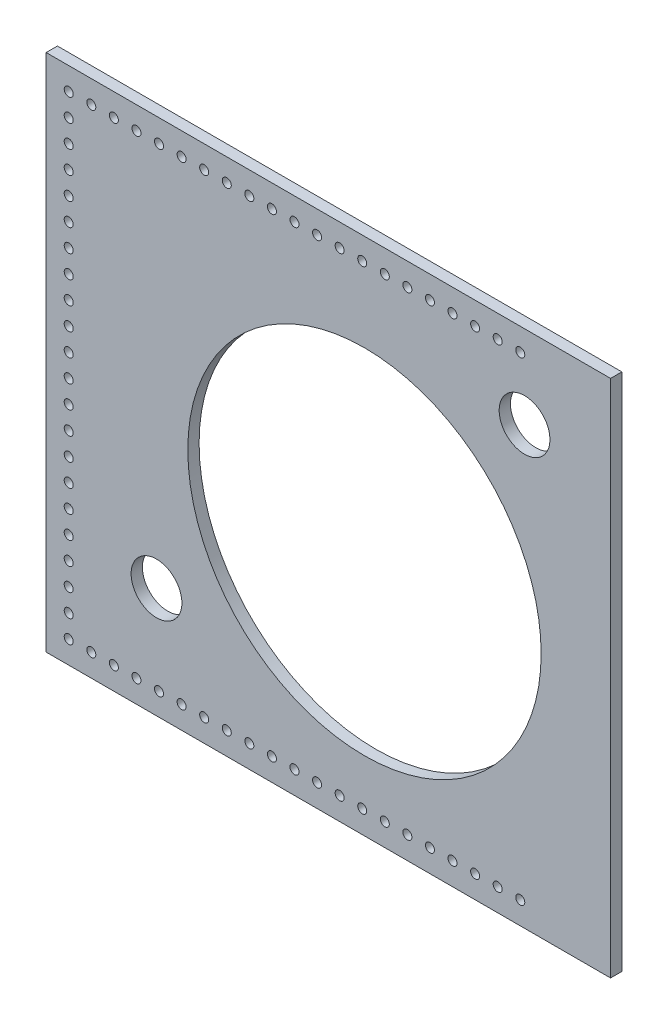
from build123d import *

# Parameters (mm, degrees)
SKETCH1_W           = 317.5
SKETCH1_H           = 292.1
SKETCH1_R           = 99.3775
SKETCH1_R_2         = 2.54
BOSS_EXTRUDE1_DEPTH = 6.35
SKETCH2_R           = 14.2875
CUT_EXTRUDE1_DEPTH  = 432.473037976


with BuildPart() as part:
    # Sketch1 → Boss-Extrude1 (new body)
    with BuildSketch(Plane.XY):
        with Locations((158.75, 146.05)):
            Rectangle(SKETCH1_W, SKETCH1_H)
        with Locations((179.07, 138.43)):
            Circle(SKETCH1_R, mode=Mode.SUBTRACT)
        with Locations((12.7, 279.4)):
            Circle(SKETCH1_R_2, mode=Mode.SUBTRACT)
        with Locations((25.4, 279.4)):
            Circle(SKETCH1_R_2, mode=Mode.SUBTRACT)
        with Locations((38.1, 279.4)):
            Circle(SKETCH1_R_2, mode=Mode.SUBTRACT)
        with Locations((50.8, 279.4)):
            Circle(SKETCH1_R_2, mode=Mode.SUBTRACT)
        with Locations((63.5, 279.4)):
            Circle(SKETCH1_R_2, mode=Mode.SUBTRACT)
        with Locations((76.2, 279.4)):
            Circle(SKETCH1_R_2, mode=Mode.SUBTRACT)
        with Locations((88.9, 279.4)):
            Circle(SKETCH1_R_2, mode=Mode.SUBTRACT)
        with Locations((101.6, 279.4)):
            Circle(SKETCH1_R_2, mode=Mode.SUBTRACT)
        with Locations((114.3, 279.4)):
            Circle(SKETCH1_R_2, mode=Mode.SUBTRACT)
        with Locations((127, 279.4)):
            Circle(SKETCH1_R_2, mode=Mode.SUBTRACT)
        with Locations((139.7, 279.4)):
            Circle(SKETCH1_R_2, mode=Mode.SUBTRACT)
        with Locations((152.4, 279.4)):
            Circle(SKETCH1_R_2, mode=Mode.SUBTRACT)
        with Locations((165.1, 279.4)):
            Circle(SKETCH1_R_2, mode=Mode.SUBTRACT)
        with Locations((177.8, 279.4)):
            Circle(SKETCH1_R_2, mode=Mode.SUBTRACT)
        with Locations((190.5, 279.4)):
            Circle(SKETCH1_R_2, mode=Mode.SUBTRACT)
        with Locations((203.2, 279.4)):
            Circle(SKETCH1_R_2, mode=Mode.SUBTRACT)
        with Locations((215.9, 279.4)):
            Circle(SKETCH1_R_2, mode=Mode.SUBTRACT)
        with Locations((228.6, 279.4)):
            Circle(SKETCH1_R_2, mode=Mode.SUBTRACT)
        with Locations((241.3, 279.4)):
            Circle(SKETCH1_R_2, mode=Mode.SUBTRACT)
        with Locations((254, 279.4)):
            Circle(SKETCH1_R_2, mode=Mode.SUBTRACT)
        with Locations((266.7, 279.4)):
            Circle(SKETCH1_R_2, mode=Mode.SUBTRACT)
        with Locations((12.7, 266.7)):
            Circle(SKETCH1_R_2, mode=Mode.SUBTRACT)
        with Locations((12.7, 254)):
            Circle(SKETCH1_R_2, mode=Mode.SUBTRACT)
        with Locations((12.7, 241.3)):
            Circle(SKETCH1_R_2, mode=Mode.SUBTRACT)
        with Locations((12.7, 228.6)):
            Circle(SKETCH1_R_2, mode=Mode.SUBTRACT)
        with Locations((12.7, 215.9)):
            Circle(SKETCH1_R_2, mode=Mode.SUBTRACT)
        with Locations((12.7, 203.2)):
            Circle(SKETCH1_R_2, mode=Mode.SUBTRACT)
        with Locations((12.7, 190.5)):
            Circle(SKETCH1_R_2, mode=Mode.SUBTRACT)
        with Locations((12.7, 177.8)):
            Circle(SKETCH1_R_2, mode=Mode.SUBTRACT)
        with Locations((12.7, 165.1)):
            Circle(SKETCH1_R_2, mode=Mode.SUBTRACT)
        with Locations((12.7, 152.4)):
            Circle(SKETCH1_R_2, mode=Mode.SUBTRACT)
        with Locations((12.7, 139.7)):
            Circle(SKETCH1_R_2, mode=Mode.SUBTRACT)
        with Locations((12.7, 127)):
            Circle(SKETCH1_R_2, mode=Mode.SUBTRACT)
        with Locations((12.7, 114.3)):
            Circle(SKETCH1_R_2, mode=Mode.SUBTRACT)
        with Locations((12.7, 101.6)):
            Circle(SKETCH1_R_2, mode=Mode.SUBTRACT)
        with Locations((12.7, 88.9)):
            Circle(SKETCH1_R_2, mode=Mode.SUBTRACT)
        with Locations((12.7, 76.2)):
            Circle(SKETCH1_R_2, mode=Mode.SUBTRACT)
        with Locations((12.7, 63.5)):
            Circle(SKETCH1_R_2, mode=Mode.SUBTRACT)
        with Locations((12.7, 50.8)):
            Circle(SKETCH1_R_2, mode=Mode.SUBTRACT)
        with Locations((12.7, 38.1)):
            Circle(SKETCH1_R_2, mode=Mode.SUBTRACT)
        with Locations((12.7, 25.4)):
            Circle(SKETCH1_R_2, mode=Mode.SUBTRACT)
        with Locations((12.7, 12.7)):
            Circle(SKETCH1_R_2, mode=Mode.SUBTRACT)
        with Locations((25.4, 12.7)):
            Circle(SKETCH1_R_2, mode=Mode.SUBTRACT)
        with Locations((38.1, 12.7)):
            Circle(SKETCH1_R_2, mode=Mode.SUBTRACT)
        with Locations((50.8, 12.7)):
            Circle(SKETCH1_R_2, mode=Mode.SUBTRACT)
        with Locations((63.5, 12.7)):
            Circle(SKETCH1_R_2, mode=Mode.SUBTRACT)
        with Locations((76.2, 12.7)):
            Circle(SKETCH1_R_2, mode=Mode.SUBTRACT)
        with Locations((88.9, 12.7)):
            Circle(SKETCH1_R_2, mode=Mode.SUBTRACT)
        with Locations((101.6, 12.7)):
            Circle(SKETCH1_R_2, mode=Mode.SUBTRACT)
        with Locations((114.3, 12.7)):
            Circle(SKETCH1_R_2, mode=Mode.SUBTRACT)
        with Locations((127, 12.7)):
            Circle(SKETCH1_R_2, mode=Mode.SUBTRACT)
        with Locations((139.7, 12.7)):
            Circle(SKETCH1_R_2, mode=Mode.SUBTRACT)
        with Locations((152.4, 12.7)):
            Circle(SKETCH1_R_2, mode=Mode.SUBTRACT)
        with Locations((165.1, 12.7)):
            Circle(SKETCH1_R_2, mode=Mode.SUBTRACT)
        with Locations((177.8, 12.7)):
            Circle(SKETCH1_R_2, mode=Mode.SUBTRACT)
        with Locations((190.5, 12.7)):
            Circle(SKETCH1_R_2, mode=Mode.SUBTRACT)
        with Locations((203.2, 12.7)):
            Circle(SKETCH1_R_2, mode=Mode.SUBTRACT)
        with Locations((215.9, 12.7)):
            Circle(SKETCH1_R_2, mode=Mode.SUBTRACT)
        with Locations((228.6, 12.7)):
            Circle(SKETCH1_R_2, mode=Mode.SUBTRACT)
        with Locations((241.3, 12.7)):
            Circle(SKETCH1_R_2, mode=Mode.SUBTRACT)
        with Locations((254, 12.7)):
            Circle(SKETCH1_R_2, mode=Mode.SUBTRACT)
        with Locations((266.7, 12.7)):
            Circle(SKETCH1_R_2, mode=Mode.SUBTRACT)
    extrude(amount=BOSS_EXTRUDE1_DEPTH)

    # Sketch2 → Cut-Extrude1 (cut, through all)
    with BuildSketch(Plane.XY.offset(6.35)):
        with Locations((62.079722251, 62.079722251)):
            Circle(SKETCH2_R)
        with Locations((269.10870269, 245.243491741)):
            Circle(SKETCH2_R)
    extrude(amount=-CUT_EXTRUDE1_DEPTH, mode=Mode.SUBTRACT)


solid = part.part
